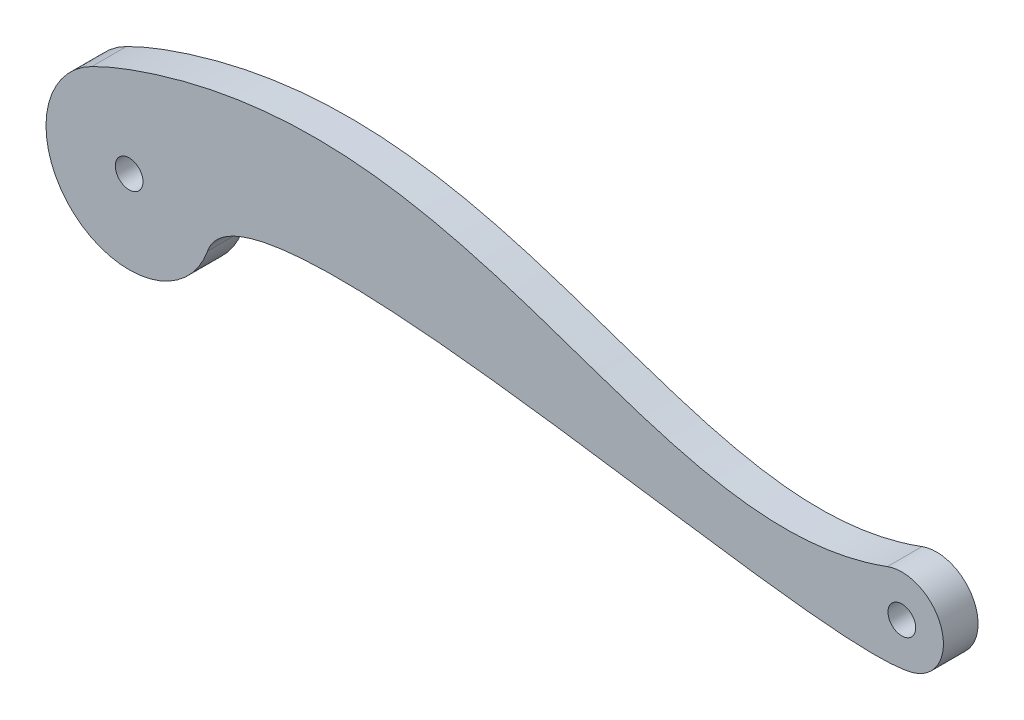
from build123d import *

# Parameters (mm, degrees)
SKETCH_1_R      = 2
EXTRUDE_1_DEPTH = 5


with BuildPart() as part:
    # 草图1 → 凸台-拉伸1 (new body)
    with BuildSketch(Plane.XY):
        with BuildLine():
            ThreePointArc((-5.386208877, 10.723280931), (-7.93650983, -9.000656183), (11.313113412, -4.001682761))
            add(Edge.make_bspline(
                [(11.313113412, -4.001682761), (17.081696115, 12.306614082), (98.341912311, -10.054285393), (113.168002994, -5.763485578)],
                knots=[0, 0, 0, 0, 0.803859609, 0.803859609, 0.803859609, 0.803859609], degree=3))
            ThreePointArc((113.168002994, -5.763485578), (117.198950963, 1.876688021), (109.417114302, 5.626862995))
            add(Edge.make_bspline(
                [(-5.386208877, 10.723280931), (-2.844619605, 11.999898674), (48.946707062, 31.778739573), (75.673836249, -6.863825211), (109.417114302, 5.626862995)],
                knots=[0, 0, 0, 0, 0.03655843, 0.731168608, 0.731168608, 0.731168608, 0.731168608], degree=3))
        make_face()
        Circle(SKETCH_1_R, mode=Mode.SUBTRACT)
        with Locations((111.5, 0)):
            Circle(SKETCH_1_R, mode=Mode.SUBTRACT)
    extrude(amount=EXTRUDE_1_DEPTH)


solid = part.part
